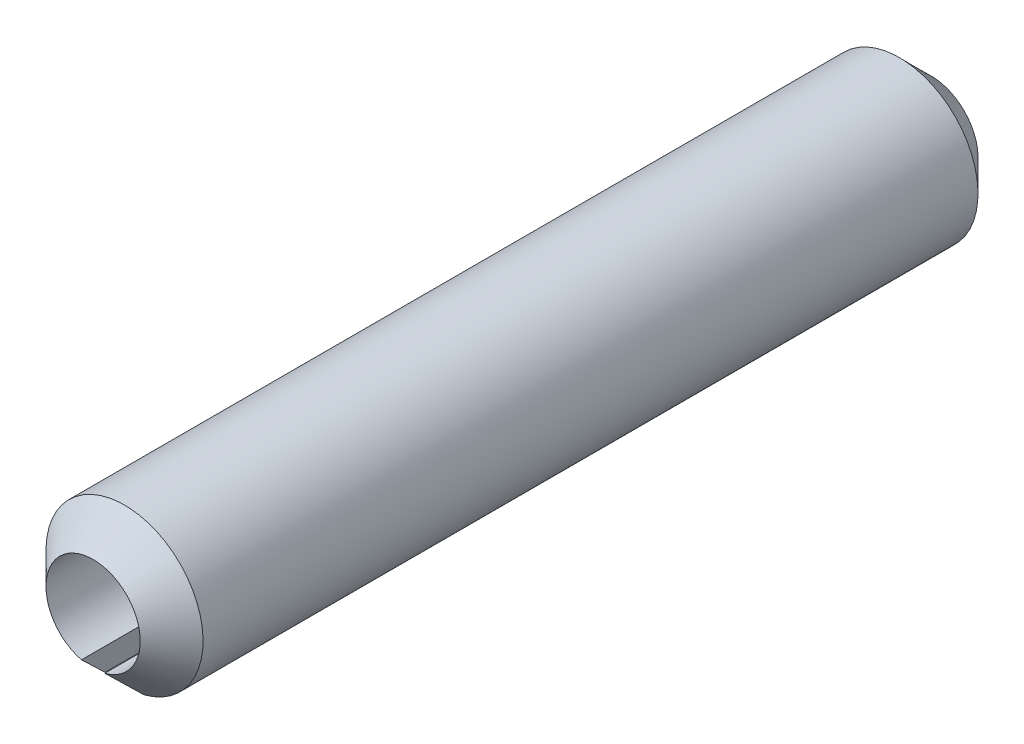
from build123d import *

# Parameters (mm, degrees)
BASE_EXTRUSION_DEPTH = 16
CHANFREIN1_SIZE      = 0.6


with BuildPart() as part:
    # Esquisse1 → Base-Extrusion (new body)
    with BuildSketch(Plane.XY):
        with BuildLine():
            Line((-0.222603523, -0.872036508), (-0.371005872, -1.45339418))
            ThreePointArc((-0.371005872, -1.45339418), (0, 1.5), (0.371005872, -1.45339418))
            Line((0.371005872, -1.45339418), (0.222603523, -0.872036508))
            ThreePointArc((0.222603523, -0.872036508), (0, 0.9), (-0.222603523, -0.872036508))
        make_face()
    extrude(amount=-BASE_EXTRUSION_DEPTH)

    # Chanfrein1
    chanfrein1_edges = [part.edges().sort_by_distance(p)[0] for p in [
        (0, 1.5, 0),
        (0, 1.5, -16),
    ]]
    chamfer(chanfrein1_edges, length=CHANFREIN1_SIZE - 0.0001)  # a hair under: the kernel refuses the full size


solid = part.part
